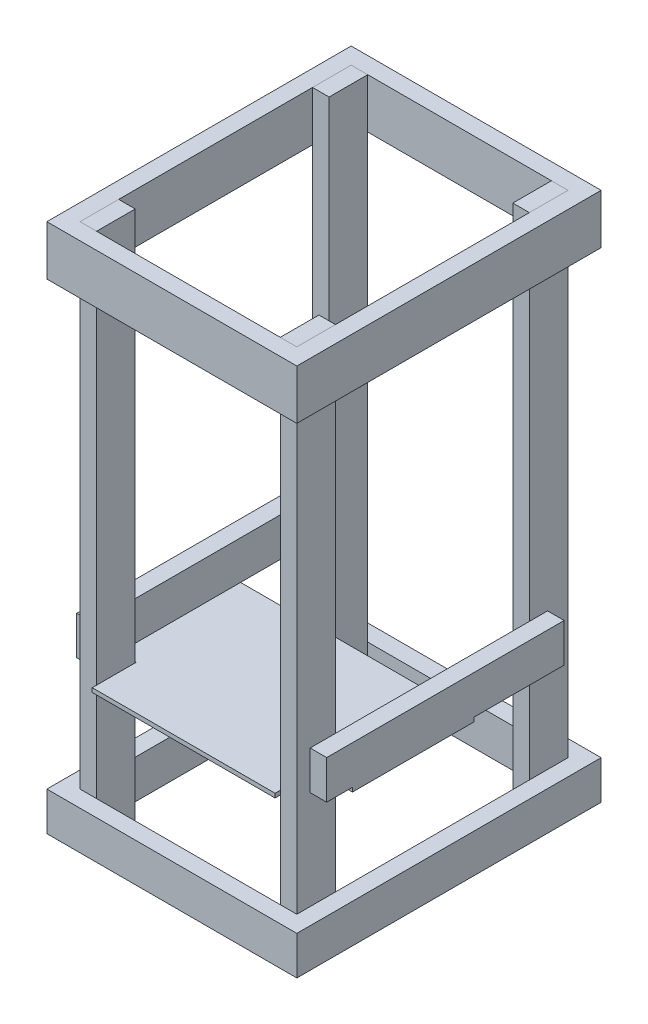
from build123d import *

# Parameters (mm, degrees)
SKETCH1_W             = 575
SKETCH1_H             = 700
SKETCH1_W_2           = 498.8
SKETCH1_H_2           = 623.8
BOSS_EXTRUDE1_DEPTH   = 114.3
SKETCH2_W             = 38.1
SKETCH2_H             = 88.9
BOSS_EXTRUDE2_DEPTH   = 1219.2
BOSS_EXTRUDE2_2_DEPTH = 1219.2
BOSS_EXTRUDE2_3_DEPTH = 1219.2
BOSS_EXTRUDE2_4_DEPTH = 1219.2
SKETCH3_W             = 575
SKETCH3_H             = 700
SKETCH3_W_2           = 498.8
SKETCH3_H_2           = 623.8
BOSS_EXTRUDE3_DEPTH   = 88.9
SKETCH7_W             = 38.1
SKETCH7_H             = 546.2345493
BOSS_EXTRUDE4_DEPTH   = 88.9
BOSS_EXTRUDE8_DEPTH   = 9.525


with BuildPart() as part:
    # Sketch1 → Boss-Extrude1 (new body)
    with BuildSketch(Plane(origin=(0, 0, 0), x_dir=(1, 0, 0), z_dir=(0, 1, 0))):
        Rectangle(SKETCH1_W, SKETCH1_H)
        Rectangle(SKETCH1_W_2, SKETCH1_H_2, mode=Mode.SUBTRACT)
    extrude(amount=BOSS_EXTRUDE1_DEPTH)


with BuildPart() as body_2:
    # Sketch2 → Boss-Extrude2 (new body)
    with BuildSketch(Plane.XZ.offset(-114.3)):
        with Locations((-230.35, 267.45)):
            Rectangle(SKETCH2_W, SKETCH2_H)
    extrude(amount=BOSS_EXTRUDE2_DEPTH)



with BuildPart() as body_3:
    # Sketch2 → Boss-Extrude2 2 (new body)
    with BuildSketch(Plane.XZ.offset(-114.3)):
        with Locations((-230.35, -267.45)):
            Rectangle(SKETCH2_W, SKETCH2_H)
    extrude(amount=BOSS_EXTRUDE2_2_DEPTH)


with BuildPart() as body_4:
    # Sketch2 → Boss-Extrude2 3 (new body)
    with BuildSketch(Plane.XZ.offset(-114.3)):
        with Locations((230.35, 267.45)):
            Rectangle(SKETCH2_W, SKETCH2_H)
    extrude(amount=BOSS_EXTRUDE2_3_DEPTH)


with BuildPart() as body_5:
    # Sketch2 → Boss-Extrude2 4 (new body)
    with BuildSketch(Plane.XZ.offset(-114.3)):
        with Locations((230.35, -267.45)):
            Rectangle(SKETCH2_W, SKETCH2_H)
    extrude(amount=BOSS_EXTRUDE2_4_DEPTH)


with BuildPart() as body_2_1:
    add(body_2.part)

    add(body_3.part)  # Boss-Extrude3 merges body 3

    add(body_4.part)  # Boss-Extrude3 merges body 4

    add(body_5.part)  # Boss-Extrude3 merges body 5
    # Sketch3 → Boss-Extrude3 (add)
    with BuildSketch(Plane.XZ.offset(1104.9)):
        Rectangle(SKETCH3_W, SKETCH3_H)
        Rectangle(SKETCH3_W_2, SKETCH3_H_2, mode=Mode.SUBTRACT)
    extrude(amount=-BOSS_EXTRUDE3_DEPTH)

    # Sketch7 → Boss-Extrude4 (add)
    with BuildSketch(Plane(origin=(0, -788.9875, 0), x_dir=(1, 0, 0), z_dir=(0, 1, 0))):
        with Locations((-268.45, -8.198642391)):
            Rectangle(SKETCH7_W, SKETCH7_H)
        with Locations((268.45, -8.198642391)):
            Rectangle(SKETCH7_W, SKETCH7_H)
    extrude(amount=BOSS_EXTRUDE4_DEPTH)

    # Sketch8 → Boss-Extrude8 (add)
    with BuildSketch(Plane.XZ.offset(788.9875)):
        Polygon((-287.5, 222), (-287.5, -57.4), (287.5, -57.4), (287.5, 222), (210.3, 222), (210.3, 322.85640623), (-210.3, 322.85640623), (-210.3, 222), align=None)
    extrude(amount=BOSS_EXTRUDE8_DEPTH)


solid = Compound([part.part, body_2_1.part])
